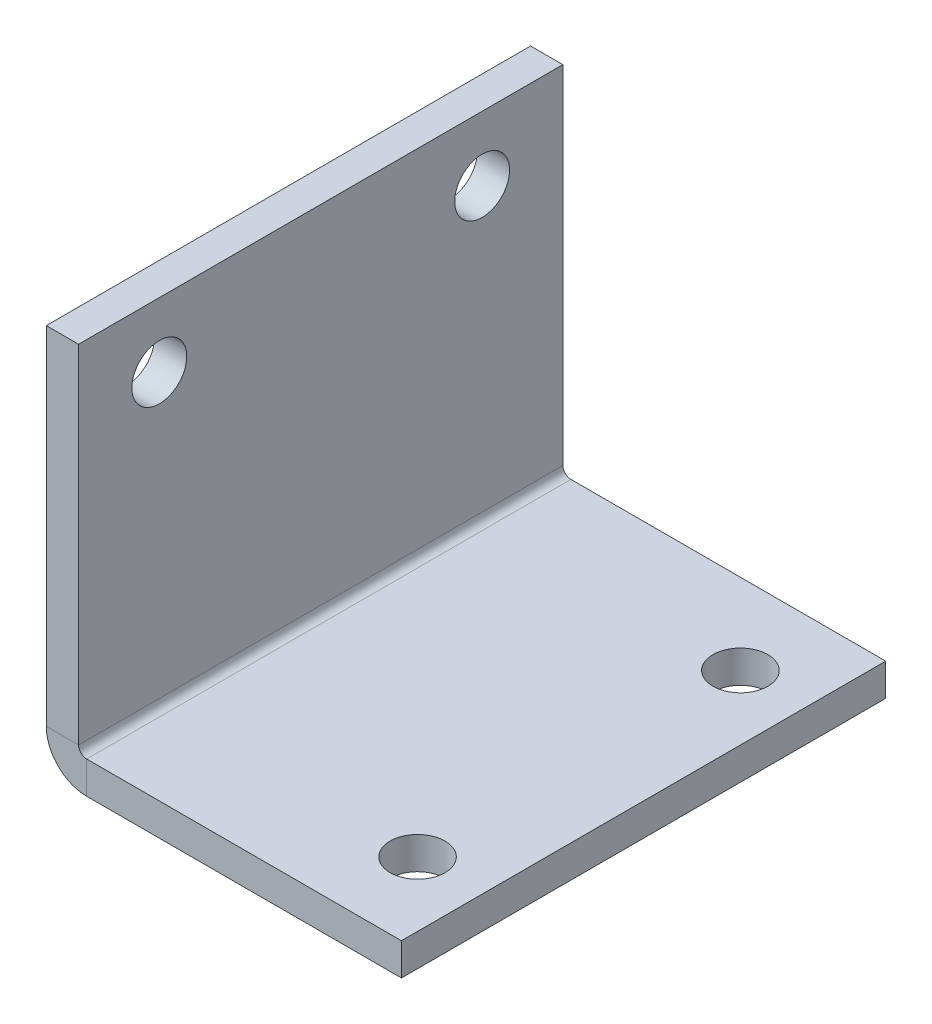
from build123d import *

# Parameters (mm, degrees)
SM_BASE_FLANGE_1_DEPTH = 30
SKETCH_6_R             = 1.7
CUT_EXTRUDE_1_DEPTH    = 10
SKETCH_7_R             = 1.7
CUT_EXTRUDE_2_DEPTH    = 10


# Sheet-metal steps are written as plain solids
with BuildPart() as part:
    # Sketch 1 → 基体-法兰1 (new body)
    with BuildSketch(Plane.XY):
        with BuildLine():
            Line((20, 0), (0.5, 0))
            ThreePointArc((0.5, 0), (0.146446609, 0.146446609), (0, 0.5))
            Line((0, 0.5), (0, 22))
            Line((0, 22), (-2, 22))
            Line((-2, 22), (-2, 0.5))
            ThreePointArc((-2, 0.5), (-1.267766953, -1.267766953), (0.5, -2))
            Line((0.5, -2), (20, -2))
            Line((20, -2), (20, 0))
        make_face()
    extrude(amount=SM_BASE_FLANGE_1_DEPTH)

    # 草图6 → 切除-拉伸1 (cut)
    with BuildSketch(Plane(origin=(0, 0, 0), x_dir=(0, 0, -1), z_dir=(1, 0, 0))):
        with Locations((-25, 18)):
            Circle(SKETCH_6_R)
        with Locations((-5, 18)):
            Circle(SKETCH_6_R)
    extrude(amount=-CUT_EXTRUDE_1_DEPTH, mode=Mode.SUBTRACT)

    # 草图7 → 切除-拉伸2 (cut)
    with BuildSketch(Plane(origin=(0, 0, 0), x_dir=(1, 0, 0), z_dir=(0, 1, 0))):
        with Locations(Location((16, -5, 0), (0, 0, 270))):
            Circle(SKETCH_7_R)
        with Locations(Location((16, -25, 0), (0, 0, 270))):
            Circle(SKETCH_7_R)
    extrude(amount=-CUT_EXTRUDE_2_DEPTH, mode=Mode.SUBTRACT)


solid = part.part
